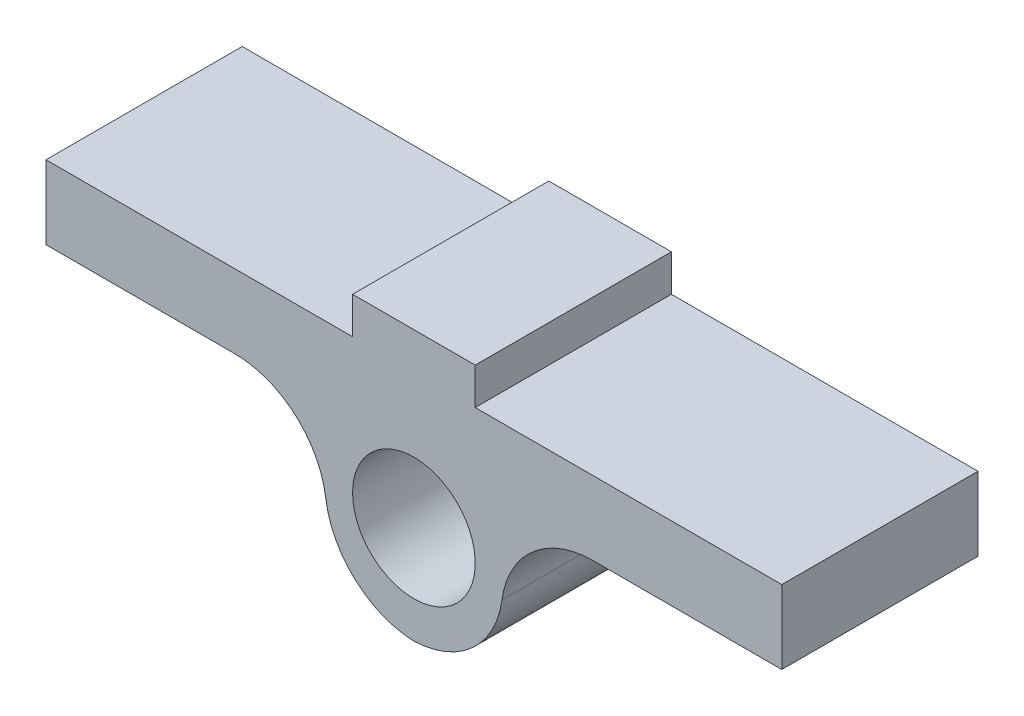
from build123d import *

# Parameters (mm, degrees)
SKETCH1_W           = 60
SKETCH1_H           = 16
BOSS_EXTRUDE1_DEPTH = 6
SKETCH2_W           = 10
SKETCH2_H           = 16
BOSS_EXTRUDE2_DEPTH = 3
SKETCH4_W           = 14.5
SKETCH4_H           = 16
BOSS_EXTRUDE3_DEPTH = 13
SKETCH5_R           = 5
CUT_EXTRUDE1_DEPTH  = 64.442887702
FILLET1_R           = 7.5
FILLET2_R           = 7.5


with BuildPart() as part:
    # Sketch1 → Boss-Extrude1 (new body)
    with BuildSketch(Plane(origin=(0, 0, 0), x_dir=(1, 0, 0), z_dir=(0, 1, 0))):
        with Locations((30, 8)):
            Rectangle(SKETCH1_W, SKETCH1_H)
    extrude(amount=BOSS_EXTRUDE1_DEPTH)

    # Sketch2 → Boss-Extrude2 (add)
    with BuildSketch(Plane(origin=(0, 6, 0), x_dir=(1, 0, 0), z_dir=(0, 1, 0))):
        with Locations((30, 8)):
            Rectangle(SKETCH2_W, SKETCH2_H)
    extrude(amount=BOSS_EXTRUDE2_DEPTH)

    # Sketch4 → Boss-Extrude3 (add)
    with BuildSketch(Plane.XZ):
        with Locations((30, -8)):
            Rectangle(SKETCH4_W, SKETCH4_H)
    extrude(amount=BOSS_EXTRUDE3_DEPTH)

    # Sketch5 → Cut-Extrude1 (cut, through all)
    with BuildSketch(Plane(origin=(0, 0, -16), x_dir=(-1, 0, 0), z_dir=(0, 0, -1))):
        with Locations((-30, -5)):
            Circle(SKETCH5_R)
    extrude(amount=-CUT_EXTRUDE1_DEPTH, mode=Mode.SUBTRACT)

    # Fillet1
    # the kernel refuses this fillet: 7.5 mm, written as the material it takes off along each edge
    with BuildSketch(Plane(origin=(22.75, -13, -34.75), x_dir=(0, 1, 0), z_dir=(0, 0, 1))) as fillet1_piece_1:
        with BuildLine():
            CenterArc((FILLET1_R, -FILLET1_R), FILLET1_R, 90, 90)
            Line((0, -FILLET1_R), (0, 0))
            Line((0, 0), (FILLET1_R, 0))
        make_face()
    extrude(amount=53.5, mode=Mode.SUBTRACT)
    with BuildSketch(Plane(origin=(37.25, -13, 18.75), x_dir=(-1, 0, 0), z_dir=(0, 0, -1))) as fillet1_piece_2:
        with BuildLine():
            CenterArc((FILLET1_R, FILLET1_R), FILLET1_R, 180, 90)
            Line((0, FILLET1_R), (0, 0))
            Line((0, 0), (FILLET1_R, 0))
        make_face()
    extrude(amount=53.5, mode=Mode.SUBTRACT)

    # Fillet2
    fillet2_edges = [part.edges().sort_by_distance(p)[0] for p in [
        (22.75, 0, -8),
        (37.25, 0, -8),
    ]]
    fillet(fillet2_edges, radius=FILLET2_R)


solid = part.part
